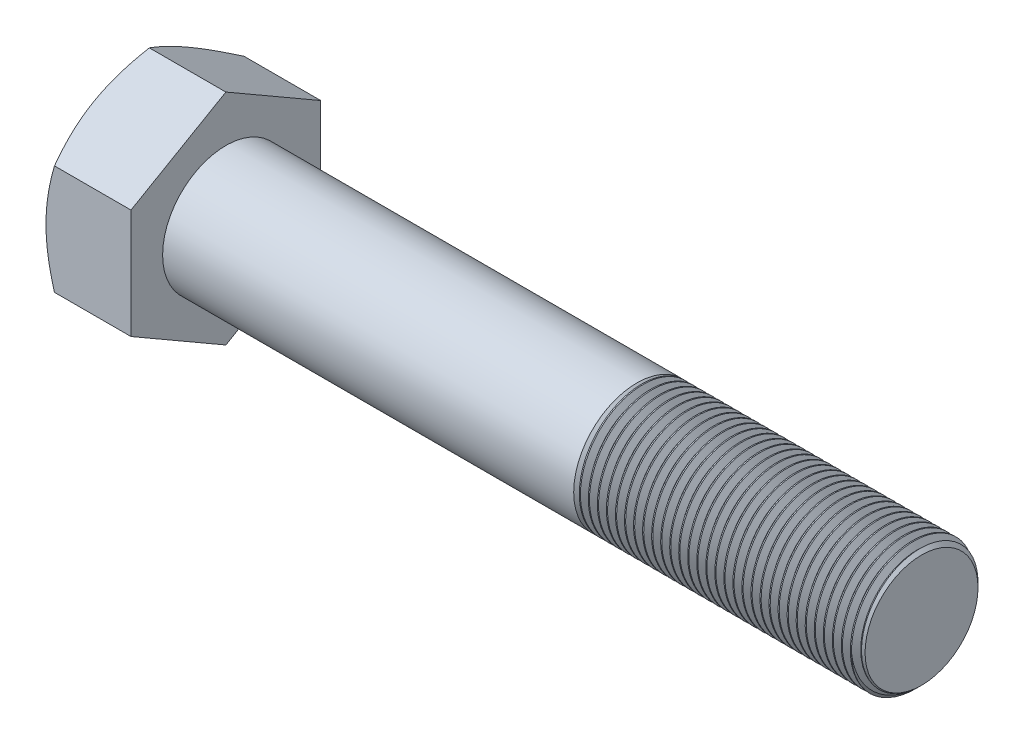
from build123d import *

# Parameters (mm, degrees)
SKETCH5_R           = 12.7
BOSS_EXTRUDE3_DEPTH = 139.7
CHAMFER1_SIZE       = 1.360714286
CUT_SWEEP1_PITCH    = 1.814285714
BOSS_EXTRUDE4_DEPTH = 17.065625
SKETCH8_OUTSIDE_W   = 629.336
SKETCH8_OUTSIDE_H   = 635.23
SKETCH8_OUTSIDE_R   = 19.05
CUT_EXTRUDE3_DEPTH  = 160.443512609
CUT_EXTRUDE3_DRAFT  = -60
CUT_EXTRUDE4_DEPTH  = 0.254
CIRPATTERN1_COUNT   = 3


with BuildPart() as part:
    # Sketch5 → Boss-Extrude3 (new body)
    with BuildSketch(Plane(origin=(78.3828125, 0, 0), x_dir=(0, 0, -1), z_dir=(1, 0, 0))):
        Circle(SKETCH5_R)
    extrude(amount=-BOSS_EXTRUDE3_DEPTH)

    # Chamfer1
    chamfer1_edges = [part.edges().sort_by_distance(p)[0] for p in [
        (78.3828125, 0, 12.7),
    ]]
    chamfer(chamfer1_edges, length=CHAMFER1_SIZE)

    # Cut-Sweep1: the profile of Sketch10 profile screwed along a right-hand helix of 32.5 turns, 10 arcs to a turn; built about Z, then put on its axis
    cut_sweep1_z = Axis((0, 0, 0), (0, 0, 1))
    cut_sweep1_corners = [(12.7003, 0, 0.000173205), (11.521586861, 0, -0.680357143), (11.521586861, 0, -0.907142857), (12.7003, 0, -1.587673205)]
    with BuildLine(mode=Mode.PRIVATE) as cut_sweep1_profile:
        Line(cut_sweep1_corners[0], cut_sweep1_corners[1])
        Line(cut_sweep1_corners[1], cut_sweep1_corners[2])
        Line(cut_sweep1_corners[2], cut_sweep1_corners[3])
        Line(cut_sweep1_corners[3], cut_sweep1_corners[0])
    cut_sweep1_cap = Face(cut_sweep1_profile.wire())
    cut_sweep1_turn_angles = [0, 18, 36, 54, 72, 90, 108, 126, 144, 162, 180, 198, 216, 234, 252, 270, 288, 306, 324, 342, 360]
    cut_sweep1_turn_weights = [1, 0.9510565162951535, 1, 0.9510565162951535, 1, 0.9510565162951535, 1, 0.9510565162951535, 1, 0.9510565162951535, 1, 0.9510565162951535, 1, 0.9510565162951535, 1, 0.9510565162951535, 1, 0.9510565162951535, 1, 0.9510565162951535, 1]
    cut_sweep1_turn_rails = [Edge.make_bspline([Vector(p[0], p[1], 0).rotate(cut_sweep1_z, cut_sweep1_turn_angles[k]) / cut_sweep1_turn_weights[k] + Vector(0, 0, p[2] + CUT_SWEEP1_PITCH * cut_sweep1_turn_angles[k] / 360) for k in range(21)], [0, 0, 0, 1, 1, 2, 2, 3, 3, 4, 4, 5, 5, 6, 6, 7, 7, 8, 8, 9, 9, 10, 10, 10], 2, cut_sweep1_turn_weights) for p in cut_sweep1_corners]
    cut_sweep1_turn_sides = [Face.make_surface_from_curves(cut_sweep1_turn_rails[p[0]], cut_sweep1_turn_rails[p[1]]) for p in [(0, 1), (1, 2), (2, 3), (3, 0)]]
    cut_sweep1_last_angles = [11520, 11538, 11556, 11574, 11592, 11610, 11628, 11646, 11664, 11682, 11700]
    cut_sweep1_last_weights = [1, 0.9510565162951535, 1, 0.9510565162951535, 1, 0.9510565162951535, 1, 0.9510565162951535, 1, 0.9510565162953007, 1]
    cut_sweep1_last_rails = [Edge.make_bspline([Vector(p[0], p[1], 0).rotate(cut_sweep1_z, cut_sweep1_last_angles[k]) / cut_sweep1_last_weights[k] + Vector(0, 0, p[2] + CUT_SWEEP1_PITCH * cut_sweep1_last_angles[k] / 360) for k in range(11)], [0, 0, 0, 1, 1, 2, 2, 3, 3, 4, 4, 5, 5, 5], 2, cut_sweep1_last_weights) for p in cut_sweep1_corners]
    cut_sweep1_last_sides = [Face.make_surface_from_curves(cut_sweep1_last_rails[p[0]], cut_sweep1_last_rails[p[1]]) for p in [(0, 1), (1, 2), (2, 3), (3, 0)]]
    cut_sweep1 = Plane(origin=(78.3828125, 0, 0), x_dir=(0, 1, 0), z_dir=(-1, 0, 0)) * Solid(Shell([*[p.moved(Location((0, 0, CUT_SWEEP1_PITCH * i))) for i in range(32) for p in cut_sweep1_turn_sides], *cut_sweep1_last_sides, cut_sweep1_cap, cut_sweep1_cap.rotate(cut_sweep1_z, 11700).moved(Location((0, 0, CUT_SWEEP1_PITCH * 11700 / 360)))]))
    add(cut_sweep1, mode=Mode.SUBTRACT)

    # Sketch11 → Revolve1 (revolve)
    with BuildSketch(Plane.XY, mode=Mode.PRIVATE) as revolve1_sk:
        Polygon((-61.3171875, 12.7), (-61.3171875, 0), (33.9328125, 0), (21.2328125, 12.7), align=None)
    revolve(revolve1_sk.sketch.rotate(Axis((-61.3171875, 0, 0), (1, 0, 0)), 270), axis=Axis((-61.3171875, 0, 0), (1, 0, 0)))

    # Sketch6 → Boss-Extrude4 (add)
    with BuildSketch(Plane.ZY.offset(61.3171875)):
        Polygon((19.05, 10.998522628), (0, 21.997045256), (-19.05, 10.998522628), (-19.05, -10.998522628), (0, -21.997045256), (19.05, -10.998522628), align=None)
    extrude(amount=BOSS_EXTRUDE4_DEPTH)


with BuildPart() as cut_extrude3_tool:
    # Sketch8 outside → Cut-Extrude3 (with draft: the straight prism first)
    with BuildSketch(Plane.ZY.offset(78.3828125)):
        Rectangle(SKETCH8_OUTSIDE_W, SKETCH8_OUTSIDE_H)
        Circle(SKETCH8_OUTSIDE_R, mode=Mode.SUBTRACT)
    extrude(amount=-CUT_EXTRUDE3_DEPTH)
    # Cut-Extrude3: the draft: its side faces are tilted about the plane it starts from
    cut_extrude3_sides = [cut_extrude3_tool.faces().sort_by_distance(p)[0] for p in [
        (1.838943804, -317.615, 0),
        (1.838943804, 0, 314.668),
        (1.838943804, 317.615, 0),
        (1.838943804, 0, -314.668),
        (1.838943804, 0, -19.05),
    ]]
    draft(cut_extrude3_sides, Plane.ZY.offset(78.3828125), CUT_EXTRUDE3_DRAFT)


with BuildPart() as part_1:
    add(part.part)

    # Cut-Extrude3: cut by cut_extrude3_tool
    add(cut_extrude3_tool.part, mode=Mode.SUBTRACT)

    # Sketch12 → Cut-Extrude4 (cut)
    with BuildSketch(Plane.ZY.offset(78.3828125)):
        with BuildLine():
            Line((0.5715, 14.6685), (0.5715, 8.1915))
            ThreePointArc((0.5715, 8.1915), (0, 7.62), (-0.5715, 8.1915))
            Line((-0.5715, 8.1915), (-0.5715, 14.6685))
            ThreePointArc((-0.5715, 14.6685), (0, 15.24), (0.5715, 14.6685))
        make_face()
    cut_extrude4 = extrude(amount=-CUT_EXTRUDE4_DEPTH, mode=Mode.SUBTRACT)

    # CirPattern1: Cut-Extrude4 ×3 about axis
    cirpattern1_axis = Axis((0, 0, 0), (1, 0, 0))
    for i in range(1, CIRPATTERN1_COUNT):
        add(cut_extrude4.rotate(cirpattern1_axis, i * 360 / CIRPATTERN1_COUNT), mode=Mode.SUBTRACT)


solid = part_1.part
